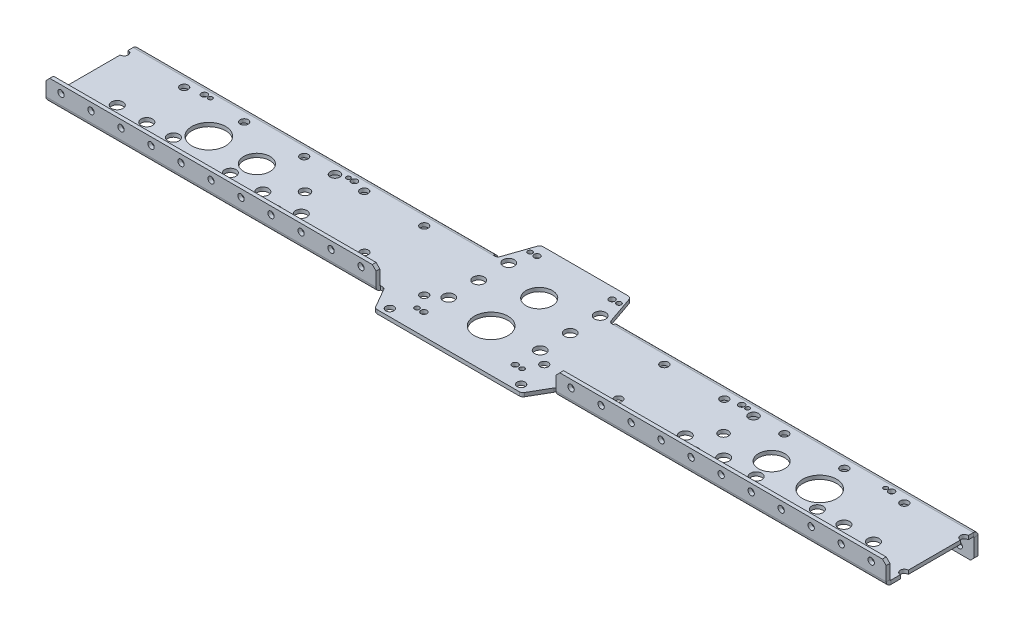
from build123d import *

# Parameters (mm, degrees)
SKETCH1_W                  = 812.8
SKETCH1_H                  = 69.85
BOSS_EXTRUDE1_DEPTH        = 3.175
SKETCH3_R                  = 14.2875
CUT_EXTRUDE1_DEPTH         = 816.802024467
EDGE_FLANGE1_DEPTH         = 812.8
EDGE_FLANGE2_DEPTH         = 812.8
SKETCH10_R                 = 4.826
LONG_6WD_DEPTH             = 817.444922817
SKETCH11_R                 = 4.826
SHORT_6WD_DEPTH            = 817.444922817
SKETCH12_R                 = 3.3528
F_8WD_EGG_DEPTH            = 817.444922817
SKETCH14_R                 = 2.667
UPPER_FLANGE_HP_DEPTH      = 817.729920277
SKETCH16_R                 = 2.667
LOWER_FLANGE_HP_DEPTH      = 817.433889486
LPATTERN1_COUNT            = 32
LPATTERN1_PITCH            = 25.4
SKETCH17_W                 = 152.4
SKETCH17_H                 = 6.35
CUT_EXTRUDE9_DEPTH         = 818.031193633
SKETCH18_W                 = 146.05
SKETCH18_H                 = 3.175
BOSS_EXTRUDE2_DEPTH        = 19.05
SKETCH19_W                 = 101.6
SKETCH19_H                 = 3.937
CUT_EXTRUDE10_DEPTH        = 818.031193633
SKETCH20_W                 = 95.25
SKETCH20_H                 = 3.175
BOSS_EXTRUDE3_DEPTH        = 27.432
CUT_EXTRUDE14_DEPTH        = 819.902667079
SKETCH21_R                 = 11.1125
SKETCH21_R_2               = 4.7625
SKETCH21_R_3               = 2.54
SKETCH21_R_4               = 2.032
TB_MINI_SHAFT_PLATE_DEPTH  = 819.8226487
CUT_EXTRUDE12_DEPTH        = 819.8226487
SKETCH26_R                 = 3.4036
SONIC_MOUNTING_HOLES_DEPTH = 819.902667079
SKETCH29_R                 = 2.5527
SKETCH29_R_2               = 1.7859375
SKETCH29_R_3               = 14.2875
SKETCH29_R_4               = 11.1125
SKETCH29_R_5               = 4.064
TB_MICRO_MOUNTING_DEPTH    = 819.902667079
FILLET1_R                  = 3.175
CHAMFER1_SIZE              = 3.175
SKETCH34_R                 = 3.3782
CUT_EXTRUDE17_DEPTH        = 819.902667079
SKETCH35_W                 = 50.8
SKETCH35_H                 = 77.724
CUT_EXTRUDE18_DEPTH        = 820.487179597
CHAMFER2_SIZE              = 3.175


# Sheet-metal steps are written as plain solids
with BuildPart() as part:
    # Sketch1 → Boss-Extrude1 (new body)
    with BuildSketch(Plane(origin=(0, 0, 0), x_dir=(1, 0, 0), z_dir=(0, 1, 0))):
        with Locations((406.4, 34.925)):
            Rectangle(SKETCH1_W, SKETCH1_H)
    extrude(amount=BOSS_EXTRUDE1_DEPTH)

    # Sketch3 → Cut-Extrude1 (cut, through all)
    with BuildSketch(Plane(origin=(0, 3.175, 0), x_dir=(1, 0, 0), z_dir=(0, 1, 0))):
        with Locations(Location((406.4, 17.272, 0), (0, 0, 270))):
            Circle(SKETCH3_R)
    extrude(amount=-CUT_EXTRUDE1_DEPTH, mode=Mode.SUBTRACT)

    # Edge-Flange1 section (across the edge) → Edge-Flange1 (add)
    with BuildSketch(Plane(origin=(0, 3.175, 0.762), x_dir=(0, 0, -1), z_dir=(1, 0, 0))):
        with BuildLine():
            Line((-3.175, 0.762), (-3.175, 15.875))
            Line((-3.175, 15.875), (0, 15.875))
            Line((0, 15.875), (0, 0.762))
            ThreePointArc((0, 0.762), (0.223184633, 0.223184633), (0.762, 0))
            Line((0.762, 0), (0.762, -3.175))
            ThreePointArc((0.762, -3.175), (-2.021879398, -2.021879398), (-3.175, 0.762))
        make_face()
    extrude(amount=EDGE_FLANGE1_DEPTH)

    # Edge-Flange2 section (across the edge) → Edge-Flange2 (add)
    with BuildSketch(Plane(origin=(0, 0, -70.612), x_dir=(0, 0, 1), z_dir=(1, 0, 0))):
        with BuildLine():
            Line((-3.175, 0.762), (-3.175, 19.05))
            Line((-3.175, 19.05), (0, 19.05))
            Line((0, 19.05), (0, 0.762))
            ThreePointArc((0, 0.762), (0.223184633, 0.223184633), (0.762, 0))
            Line((0.762, 0), (0.762, -3.175))
            ThreePointArc((0.762, -3.175), (-2.021879398, -2.021879398), (-3.175, 0.762))
        make_face()
    extrude(amount=EDGE_FLANGE2_DEPTH)

    # Sketch10 → Long 6wd (cut, through all)
    with BuildSketch(Plane(origin=(0, 3.175, 0), x_dir=(1, 0, 0), z_dir=(0, 1, 0))):
        with Locations(Location((86.339113657, 20.828, 0), (0, 0, 270))):
            Circle(SKETCH10_R)
        with Locations(Location((111.349627997, 20.828, 0), (0, 0, 270))):
            Circle(SKETCH10_R)
        with Locations(Location((133.855797334, 20.828, 0), (0, 0, 270))):
            Circle(SKETCH10_R)
        with Locations(Location((726.460886343, 20.828, 0), (0, 0, 270))):
            Circle(SKETCH10_R)
        with Locations(Location((701.450372003, 20.828, 0), (0, 0, 270))):
            Circle(SKETCH10_R)
        with Locations(Location((678.944202666, 20.828, 0), (0, 0, 270))):
            Circle(SKETCH10_R)
    extrude(amount=-LONG_6WD_DEPTH, mode=Mode.SUBTRACT)

    # Sketch11 → Short 6wd (cut, through all)
    with BuildSketch(Plane(origin=(0, 3.175, 0), x_dir=(1, 0, 0), z_dir=(0, 1, 0))):
        with Locations(Location((183.852302373, 19.05, 0), (0, 0, 270))):
            Circle(SKETCH11_R)
        with Locations(Location((211.361504088, 19.05, 0), (0, 0, 270))):
            Circle(SKETCH11_R)
        with Locations(Location((243.875125248, 19.05, 0), (0, 0, 270))):
            Circle(SKETCH11_R)
        with Locations(Location((568.924874752, 19.05, 0), (0, 0, 270))):
            Circle(SKETCH11_R)
        with Locations(Location((601.438495912, 19.05, 0), (0, 0, 270))):
            Circle(SKETCH11_R)
        with Locations(Location((628.947697627, 19.05, 0), (0, 0, 270))):
            Circle(SKETCH11_R)
    extrude(amount=-SHORT_6WD_DEPTH, mode=Mode.SUBTRACT)

    # Sketch12 → 8wd egg (cut, through all)
    with BuildSketch(Plane(origin=(0, 3.175, 0), x_dir=(1, 0, 0), z_dir=(0, 1, 0))):
        with Locations(Location((298.874532383, 17.547282407, 0), (0, 0, 270))):
            Circle(SKETCH12_R)
        with Locations(Location((513.925467617, 17.547282407, 0), (0, 0, 270))):
            Circle(SKETCH12_R)
    extrude(amount=-F_8WD_EGG_DEPTH, mode=Mode.SUBTRACT)

    # Sketch14 → upper flange HP (cut, through all)
    with BuildSketch(Plane(origin=(0, 0, -73.787), x_dir=(-1, 0, 0), z_dir=(0, 0, -1))):
        with Locations(Location((-12.7, -12.7, 0), (0, 0, 90))):
            Circle(SKETCH14_R)
        with Locations(Location((-38.1, -12.7, 0), (0, 0, 90))):
            Circle(SKETCH14_R)
        with Locations(Location((-63.5, -12.7, 0), (0, 0, 90))):
            Circle(SKETCH14_R)
        with Locations(Location((-88.9, -12.7, 0), (0, 0, 90))):
            Circle(SKETCH14_R)
        with Locations(Location((-114.3, -12.7, 0), (0, 0, 90))):
            Circle(SKETCH14_R)
        with Locations(Location((-139.7, -12.7, 0), (0, 0, 90))):
            Circle(SKETCH14_R)
        with Locations(Location((-165.1, -12.7, 0), (0, 0, 90))):
            Circle(SKETCH14_R)
        with Locations(Location((-190.5, -12.7, 0), (0, 0, 90))):
            Circle(SKETCH14_R)
        with Locations(Location((-215.9, -12.7, 0), (0, 0, 90))):
            Circle(SKETCH14_R)
        with Locations(Location((-241.3, -12.7, 0), (0, 0, 90))):
            Circle(SKETCH14_R)
        with Locations(Location((-266.7, -12.7, 0), (0, 0, 90))):
            Circle(SKETCH14_R)
        with Locations(Location((-292.1, -12.7, 0), (0, 0, 90))):
            Circle(SKETCH14_R)
        with Locations(Location((-317.5, -12.7, 0), (0, 0, 90))):
            Circle(SKETCH14_R)
        with Locations(Location((-342.9, -12.7, 0), (0, 0, 90))):
            Circle(SKETCH14_R)
        with Locations(Location((-368.3, -12.7, 0), (0, 0, 90))):
            Circle(SKETCH14_R)
        with Locations(Location((-393.7, -12.7, 0), (0, 0, 90))):
            Circle(SKETCH14_R)
        with Locations(Location((-419.1, -12.7, 0), (0, 0, 90))):
            Circle(SKETCH14_R)
        with Locations(Location((-444.5, -12.7, 0), (0, 0, 90))):
            Circle(SKETCH14_R)
        with Locations(Location((-469.9, -12.7, 0), (0, 0, 90))):
            Circle(SKETCH14_R)
        with Locations(Location((-495.3, -12.7, 0), (0, 0, 90))):
            Circle(SKETCH14_R)
        with Locations(Location((-520.7, -12.7, 0), (0, 0, 90))):
            Circle(SKETCH14_R)
        with Locations(Location((-546.1, -12.7, 0), (0, 0, 90))):
            Circle(SKETCH14_R)
        with Locations(Location((-571.5, -12.7, 0), (0, 0, 90))):
            Circle(SKETCH14_R)
        with Locations(Location((-596.9, -12.7, 0), (0, 0, 90))):
            Circle(SKETCH14_R)
        with Locations(Location((-622.3, -12.7, 0), (0, 0, 90))):
            Circle(SKETCH14_R)
        with Locations(Location((-647.7, -12.7, 0), (0, 0, 90))):
            Circle(SKETCH14_R)
        with Locations(Location((-673.1, -12.7, 0), (0, 0, 90))):
            Circle(SKETCH14_R)
        with Locations(Location((-698.5, -12.7, 0), (0, 0, 90))):
            Circle(SKETCH14_R)
        with Locations(Location((-723.9, -12.7, 0), (0, 0, 90))):
            Circle(SKETCH14_R)
        with Locations(Location((-749.3, -12.7, 0), (0, 0, 90))):
            Circle(SKETCH14_R)
        with Locations(Location((-774.7, -12.7, 0), (0, 0, 90))):
            Circle(SKETCH14_R)
        with Locations(Location((-800.1, -12.7, 0), (0, 0, 90))):
            Circle(SKETCH14_R)
    extrude(amount=-UPPER_FLANGE_HP_DEPTH, mode=Mode.SUBTRACT)

    # Sketch16 → Lower flange HP (cut, through all)
    with BuildSketch(Plane(origin=(0, 0, 0.762), x_dir=(-1, 0, 0), z_dir=(0, 0, -1))):
        with Locations(Location((-12.7, 12.7, 0), (0, 0, 90))):
            Circle(SKETCH16_R)
    lower_flange_hp = extrude(amount=-LOWER_FLANGE_HP_DEPTH, mode=Mode.SUBTRACT)

    # LPattern1: Lower flange HP ×32
    with Locations(*[(i * LPATTERN1_PITCH, 0, 0) for i in range(1, LPATTERN1_COUNT)]):
        add(lower_flange_hp, mode=Mode.SUBTRACT)

    # Sketch17 → Cut-Extrude9 (cut, through all)
    with BuildSketch(Plane(origin=(0, 19.05, 0), x_dir=(1, 0, 0), z_dir=(0, 1, 0))):
        with Locations((406.4, -3.175)):
            Rectangle(SKETCH17_W, SKETCH17_H)
    extrude(amount=-CUT_EXTRUDE9_DEPTH, mode=Mode.SUBTRACT)

    # Sketch18 → Boss-Extrude2 (add)
    with BuildSketch(Plane.XY):
        with Locations((406.4, 1.5875)):
            Rectangle(SKETCH18_W, SKETCH18_H)
    extrude(amount=BOSS_EXTRUDE2_DEPTH)

    # Sketch19 → Cut-Extrude10 (cut, through all)
    with BuildSketch(Plane.XZ.offset(19.05)):
        with Locations((406.4, -71.8185)):
            Rectangle(SKETCH19_W, SKETCH19_H)
    extrude(amount=-CUT_EXTRUDE10_DEPTH, mode=Mode.SUBTRACT)

    # Sketch20 → Boss-Extrude3 (add)
    with BuildSketch(Plane(origin=(0, 0, -69.85), x_dir=(-1, 0, 0), z_dir=(0, 0, -1))):
        with Locations((-406.4, 1.5875)):
            Rectangle(SKETCH20_W, SKETCH20_H)
    extrude(amount=BOSS_EXTRUDE3_DEPTH)

    # Sketch27 → Cut-Extrude14 (cut, through all)
    with BuildSketch(Plane(origin=(0, 3.175, 0), x_dir=(1, 0, 0), z_dir=(0, 1, 0))):
        Polygon((333.375, 0), (344.373522628, -19.05), (333.375, -19.05), align=None)
        Polygon((479.425, 0), (479.425, -19.05), (468.426477372, -19.05), align=None)
    extrude(amount=-CUT_EXTRUDE14_DEPTH, mode=Mode.SUBTRACT)

    # Sketch21 → TB Mini Shaft plate (cut, through all)
    with BuildSketch(Plane.XZ):
        with Locations(Location((406.4, -57.9628, 0), (0, 0, 270))):
            Circle(SKETCH21_R)
        with Locations(Location((445.12429721, -45.466, 0), (0, 0, 270))):
            Circle(SKETCH21_R_2)
        with Locations(Location((367.67570279, -45.466, 0), (0, 0, 270))):
            Circle(SKETCH21_R_2)
        with Locations(Location((445.12429721, -70.866, 0), (0, 0, 270))):
            Circle(SKETCH21_R_2)
        with Locations(Location((445.12429721, -20.066, 0), (0, 0, 270))):
            Circle(SKETCH21_R_2)
        with Locations(Location((367.67570279, -20.066, 0), (0, 0, 270))):
            Circle(SKETCH21_R_2)
        with Locations(Location((367.67570279, -70.866, 0), (0, 0, 270))):
            Circle(SKETCH21_R_2)
        with Locations(Location((438.15, -87.85352, 0), (0, 0, 270))):
            Circle(SKETCH21_R_3)
        with Locations(Location((374.65, -87.85352, 0), (0, 0, 270))):
            Circle(SKETCH21_R_3)
        with Locations(Location((443.992, -87.85352, 0), (0, 0, 270))):
            Circle(SKETCH21_R_4)
        with Locations(Location((368.808, -87.85352, 0), (0, 0, 270))):
            Circle(SKETCH21_R_4)
        with Locations(Location((445.0461, 1.03886, 0), (0, 0, 270))):
            Circle(SKETCH21_R_3)
        with Locations(Location((367.7539, 1.03886, 0), (0, 0, 270))):
            Circle(SKETCH21_R_3)
        with Locations(Location((361.9119, 1.03886, 0), (0, 0, 270))):
            Circle(SKETCH21_R_4)
        with Locations(Location((450.8881, 1.03886, 0), (0, 0, 270))):
            Circle(SKETCH21_R_4)
    extrude(amount=-TB_MINI_SHAFT_PLATE_DEPTH, mode=Mode.SUBTRACT)

    # Sketch22 → Cut-Extrude12 (cut, through all)
    with BuildSketch(Plane.XZ):
        Polygon((454.025, -69.85), (444.579404912, -97.282), (454.025, -97.282), align=None)
        Polygon((358.775, -69.85), (368.220595088, -97.282), (358.775, -97.282), align=None)
    extrude(amount=-CUT_EXTRUDE12_DEPTH, mode=Mode.SUBTRACT)

    # Sketch26 → Sonic mounting holes (cut, through all)
    with BuildSketch(Plane(origin=(0, 3.175, 0), x_dir=(1, 0, 0), z_dir=(0, 1, 0))):
        with Locations(Location((350.8375, -12.8905, 0), (0, 0, 270))):
            Circle(SKETCH26_R)
        with Locations(Location((461.9625, -12.8905, 0), (0, 0, 270))):
            Circle(SKETCH26_R)
    extrude(amount=-SONIC_MOUNTING_HOLES_DEPTH, mode=Mode.SUBTRACT)

    # Sketch29 → TB Micro Mounting (cut, through all)
    with BuildSketch(Plane(origin=(0, 3.175, 0), x_dir=(1, 0, 0), z_dir=(0, 1, 0))):
        with Locations(Location((115.520362832, 65.405, 0), (0, 0, 270))):
            Circle(SKETCH29_R)
        with Locations(Location((120.600362832, 65.405, 0), (0, 0, 270))):
            Circle(SKETCH29_R_2)
        with Locations(Location((147.829162832, 36.83, 0), (0, 0, 270))):
            Circle(SKETCH29_R_3)
        with Locations(Location((115.520362832, 8.255, 0), (0, 0, 270))):
            Circle(SKETCH29_R)
        with Locations(Location((120.600362832, 8.255, 0), (0, 0, 270))):
            Circle(SKETCH29_R_2)
        with Locations(Location((188.545362832, 36.83, 0), (0, 0, 270))):
            Circle(SKETCH29_R_4)
        with Locations(Location((229.261562832, 36.83, 0), (0, 0, 270))):
            Circle(SKETCH29_R_5)
        with Locations(Location((229.261562832, 62.23, 0), (0, 0, 270))):
            Circle(SKETCH29_R_5)
        with Locations(Location((229.261562832, 11.43, 0), (0, 0, 270))):
            Circle(SKETCH29_R_5)
        with Locations(Location((237.440362832, 8.255, 0), (0, 0, 270))):
            Circle(SKETCH29_R_2)
        with Locations(Location((242.520362832, 8.255, 0), (0, 0, 270))):
            Circle(SKETCH29_R)
        with Locations(Location((237.440362832, 65.405, 0), (0, 0, 270))):
            Circle(SKETCH29_R_2)
        with Locations(Location((242.520362832, 65.405, 0), (0, 0, 270))):
            Circle(SKETCH29_R)
        with Locations(Location((570.279637168, 65.405, 0), (0, 0, 270))):
            Circle(SKETCH29_R)
        with Locations(Location((575.359637168, 65.405, 0), (0, 0, 270))):
            Circle(SKETCH29_R_2)
        with Locations(Location((583.538437168, 62.23, 0), (0, 0, 270))):
            Circle(SKETCH29_R_5)
        with Locations(Location((583.538437168, 36.83, 0), (0, 0, 270))):
            Circle(SKETCH29_R_5)
        with Locations(Location((624.254637168, 36.83, 0), (0, 0, 270))):
            Circle(SKETCH29_R_4)
        with Locations(Location((570.279637168, 8.255, 0), (0, 0, 270))):
            Circle(SKETCH29_R)
        with Locations(Location((575.359637168, 8.255, 0), (0, 0, 270))):
            Circle(SKETCH29_R_2)
        with Locations(Location((583.538437168, 11.43, 0), (0, 0, 270))):
            Circle(SKETCH29_R_5)
        with Locations(Location((664.970837168, 36.83, 0), (0, 0, 270))):
            Circle(SKETCH29_R_3)
        with Locations(Location((692.199637168, 65.405, 0), (0, 0, 270))):
            Circle(SKETCH29_R_2)
        with Locations(Location((697.279637168, 65.405, 0), (0, 0, 270))):
            Circle(SKETCH29_R)
        with Locations(Location((692.199637168, 8.255, 0), (0, 0, 270))):
            Circle(SKETCH29_R_2)
        with Locations(Location((697.279637168, 8.255, 0), (0, 0, 270))):
            Circle(SKETCH29_R)
    extrude(amount=-TB_MICRO_MOUNTING_DEPTH, mode=Mode.SUBTRACT)

    # Fillet1
    fillet1_edges = [part.edges().sort_by_distance(p)[0] for p in [
        (333.375, 1.5875, 0),
        (479.425, 1.5875, 0),
        (454.025, 1.5875, -69.85),
        (358.775, 1.5875, -69.85),
        (468.426477372, 1.5875, 19.05),
        (344.373522628, 1.5875, 19.05),
        (368.220595088, 1.5875, -97.282),
        (444.579404912, 1.5875, -97.282),
    ]]
    fillet(fillet1_edges, radius=FILLET1_R)

    # Chamfer1
    chamfer1_edges = [part.edges().sort_by_distance(p)[0] for p in [
        (0, 19.05, 2.3495),
        (812.8, 19.05, 2.3495),
        (0, -19.05, -72.1995),
        (482.6, 19.05, 2.3495),
        (330.2, 19.05, 2.3495),
        (812.8, -19.05, -72.1995),
        (355.6, -19.05, -72.1995),
        (457.2, -19.05, -72.1995),
    ]]
    chamfer(chamfer1_edges, length=CHAMFER1_SIZE)

    # Sketch34 → Cut-Extrude17 (cut, through all)
    with BuildSketch(Plane(origin=(0, 3.175, 0), x_dir=(1, 0, 0), z_dir=(0, 1, 0))):
        with Locations(Location((50.8, 11.43, 0), (0, 0, 270))):
            Circle(SKETCH34_R)
        with Locations(Location((50.8, 62.23, 0), (0, 0, 270))):
            Circle(SKETCH34_R)
        with Locations(Location((101.6, 62.23, 0), (0, 0, 270))):
            Circle(SKETCH34_R)
        with Locations(Location((101.6, 11.43, 0), (0, 0, 270))):
            Circle(SKETCH34_R)
        with Locations(Location((152.4, 62.23, 0), (0, 0, 270))):
            Circle(SKETCH34_R)
        with Locations(Location((152.4, 11.43, 0), (0, 0, 270))):
            Circle(SKETCH34_R)
        with Locations(Location((203.2, 62.23, 0), (0, 0, 270))):
            Circle(SKETCH34_R)
        with Locations(Location((203.2, 11.43, 0), (0, 0, 270))):
            Circle(SKETCH34_R)
        with Locations(Location((254, 62.23, 0), (0, 0, 270))):
            Circle(SKETCH34_R)
        with Locations(Location((254, 11.43, 0), (0, 0, 270))):
            Circle(SKETCH34_R)
        with Locations(Location((304.8, 62.23, 0), (0, 0, 270))):
            Circle(SKETCH34_R)
        with Locations(Location((355.6, 11.43, 0), (0, 0, 270))):
            Circle(SKETCH34_R)
        with Locations(Location((457.2, 11.43, 0), (0, 0, 270))):
            Circle(SKETCH34_R)
        with Locations(Location((508, 62.23, 0), (0, 0, 270))):
            Circle(SKETCH34_R)
        with Locations(Location((558.8, 62.23, 0), (0, 0, 270))):
            Circle(SKETCH34_R)
        with Locations(Location((558.8, 11.43, 0), (0, 0, 270))):
            Circle(SKETCH34_R)
        with Locations(Location((609.6, 62.23, 0), (0, 0, 270))):
            Circle(SKETCH34_R)
        with Locations(Location((609.6, 11.43, 0), (0, 0, 270))):
            Circle(SKETCH34_R)
        with Locations(Location((660.4, 62.23, 0), (0, 0, 270))):
            Circle(SKETCH34_R)
        with Locations(Location((660.4, 11.43, 0), (0, 0, 270))):
            Circle(SKETCH34_R)
        with Locations(Location((711.2, 62.23, 0), (0, 0, 270))):
            Circle(SKETCH34_R)
        with Locations(Location((711.2, 11.43, 0), (0, 0, 270))):
            Circle(SKETCH34_R)
        with Locations(Location((762, 62.23, 0), (0, 0, 270))):
            Circle(SKETCH34_R)
        with Locations(Location((762, 11.43, 0), (0, 0, 270))):
            Circle(SKETCH34_R)
    extrude(amount=-CUT_EXTRUDE17_DEPTH, mode=Mode.SUBTRACT)

    # Sketch35 → Cut-Extrude18 (cut, through all)
    with BuildSketch(Plane(origin=(0, 19.05, 0), x_dir=(1, 0, 0), z_dir=(0, 1, 0))):
        with Locations((25.4, 34.925)):
            Rectangle(SKETCH35_W, SKETCH35_H)
        with Locations((787.4, 34.925)):
            Rectangle(SKETCH35_W, SKETCH35_H)
    extrude(amount=-CUT_EXTRUDE18_DEPTH, mode=Mode.SUBTRACT)

    # Chamfer2
    chamfer2_edges = [part.edges().sort_by_distance(p)[0] for p in [
        (50.8, 19.05, 2.3495),
        (50.8, -19.05, -72.1995),
        (762, 19.05, 2.3495),
        (762, -19.05, -72.1995),
    ]]
    chamfer(chamfer2_edges, length=CHAMFER2_SIZE)


solid = part.part
